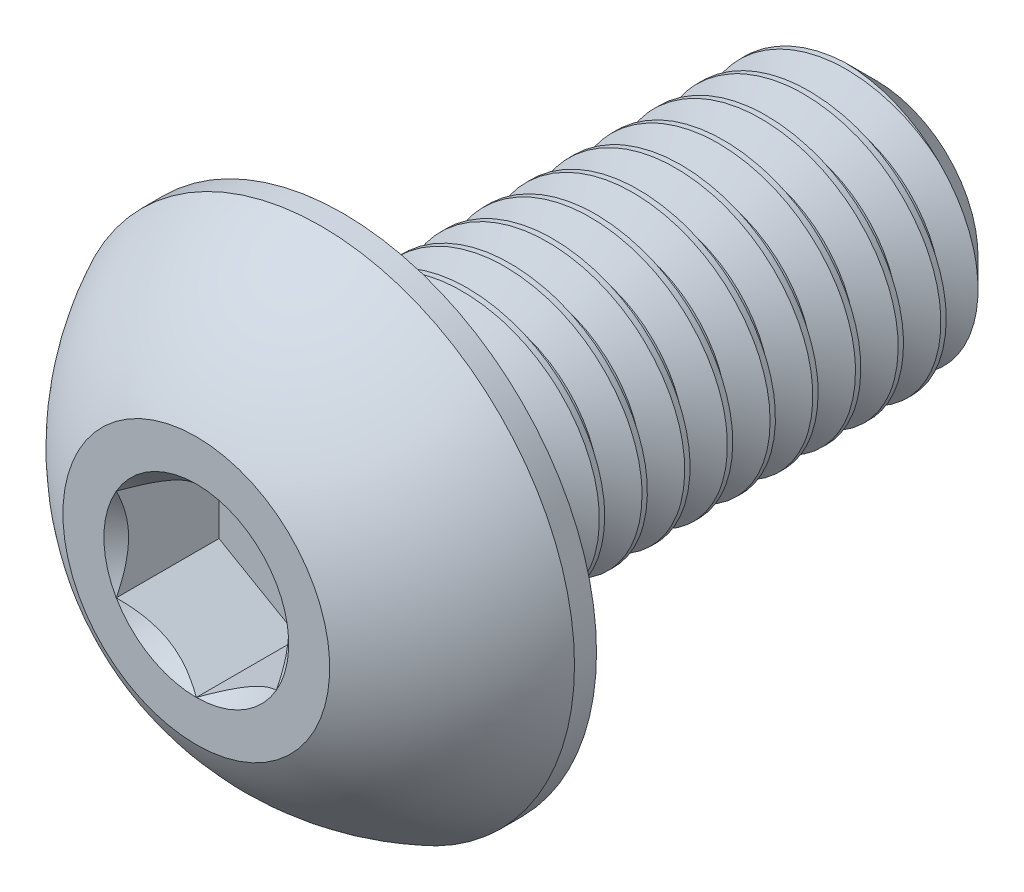
from build123d import *

# Parameters (mm, degrees)
SKETCH1_W          = 10
SKETCH1_H          = 2.5
CHAMFER1_SIZE      = 0.6
CUT_EXTRUDE2_DEPTH = 1.925
CUT_SWEEP1_PITCH   = 0.8


with BuildPart() as part:
    # Sketch1 → Revolve1 (revolve)
    with BuildSketch(Plane(origin=(0, 0, 0), x_dir=(0, 0, -1), z_dir=(1, 0, 0))):
        with Locations((7.75, 1.25)):
            Rectangle(SKETCH1_W, SKETCH1_H)
    revolve(axis=Axis((0, 0, -12.75), (0, 0, 1)))

    # Chamfer1
    chamfer1_edges = [part.edges().sort_by_distance(p)[0] for p in [
        (0, -2.5, -12.75),
    ]]
    chamfer(chamfer1_edges, length=CHAMFER1_SIZE)

    # Sketch7 → Revolve2 (revolve)
    with BuildSketch(Plane(origin=(0, 0, 0), x_dir=(0, 0, -1), z_dir=(1, 0, 0)), mode=Mode.PRIVATE) as revolve2_sk:
        with BuildLine():
            Line((2.3375, 4.75), (2.75, 4.75))
            Line((2.75, 4.75), (2.75, 0))
            Line((2.75, 0), (0, 0))
            Line((0, 0), (0, 2.5))
            ThreePointArc((0, 2.5), (0.991875183, 3.808753282), (2.3375, 4.75))
        make_face()
    revolve(revolve2_sk.sketch.rotate(Axis((0, 0, 0), (0, 0, -1)), 180), axis=Axis((0, 0, 0), (0, 0, -1)))

    # Sketch5 → Cut-Extrude2 (cut)
    with BuildSketch(Plane.XY):
        Polygon((1.5, -0.866025404), (1.5, 0.866025404), (0, 1.732050808), (-1.5, 0.866025404), (-1.5, -0.866025404), (0, -1.732050808), align=None)
    extrude(amount=-CUT_EXTRUDE2_DEPTH, mode=Mode.SUBTRACT)

    # Cut-Extrude3 cone 1 section (through the dimple's axis) → Cut-Extrude3 (revolve, cut)
    with BuildSketch(Plane(origin=(0, 0, 0), x_dir=(0, -1, 0), z_dir=(1, 0, 0))):
        Polygon((0, 0), (1.732050808, 0), (0, 1.732050808), align=None)
    revolve(axis=Axis((0, 0, 0), (0, 0, -1)), mode=Mode.SUBTRACT)

    # Cut-Sweep1: the profile of Sketch2 profile screwed along a right-hand helix of 13.5 turns, 8 arcs to a turn; built about Z, then put on its axis
    cut_sweep1_z = Axis((0, 0, 0), (0, 0, 1))
    cut_sweep1_corners = [(2.5003, 0, 0.600173205), (2.5003, 0, -0.100173205), (1.980384758, 0, 0.2), (1.980384758, 0, 0.3)]
    with BuildLine(mode=Mode.PRIVATE) as cut_sweep1_profile:
        Line(cut_sweep1_corners[0], cut_sweep1_corners[1])
        Line(cut_sweep1_corners[1], cut_sweep1_corners[2])
        Line(cut_sweep1_corners[2], cut_sweep1_corners[3])
        Line(cut_sweep1_corners[3], cut_sweep1_corners[0])
    cut_sweep1_cap = Face(cut_sweep1_profile.wire())
    cut_sweep1_turn_angles = [0, 22.5, 45, 67.5, 90, 112.5, 135, 157.5, 180, 202.5, 225, 247.5, 270, 292.5, 315, 337.5, 360]
    cut_sweep1_turn_weights = [1, 0.9238795325112867, 1, 0.9238795325112867, 1, 0.9238795325112867, 1, 0.9238795325112867, 1, 0.9238795325112867, 1, 0.9238795325112867, 1, 0.9238795325112867, 1, 0.9238795325112867, 1]
    cut_sweep1_turn_rails = [Edge.make_bspline([Vector(p[0], p[1], 0).rotate(cut_sweep1_z, cut_sweep1_turn_angles[k]) / cut_sweep1_turn_weights[k] + Vector(0, 0, p[2] + CUT_SWEEP1_PITCH * cut_sweep1_turn_angles[k] / 360) for k in range(17)], [0, 0, 0, 1, 1, 2, 2, 3, 3, 4, 4, 5, 5, 6, 6, 7, 7, 8, 8, 8], 2, cut_sweep1_turn_weights) for p in cut_sweep1_corners]
    cut_sweep1_turn_sides = [Face.make_surface_from_curves(cut_sweep1_turn_rails[p[0]], cut_sweep1_turn_rails[p[1]]) for p in [(0, 1), (1, 2), (2, 3), (3, 0)]]
    cut_sweep1_last_angles = [4680, 4702.5, 4725, 4747.5, 4770, 4792.5, 4815, 4837.5, 4860]
    cut_sweep1_last_weights = [1, 0.9238795325112867, 1, 0.9238795325112867, 1, 0.9238795325112867, 1, 0.9238795325112351, 1]
    cut_sweep1_last_rails = [Edge.make_bspline([Vector(p[0], p[1], 0).rotate(cut_sweep1_z, cut_sweep1_last_angles[k]) / cut_sweep1_last_weights[k] + Vector(0, 0, p[2] + CUT_SWEEP1_PITCH * cut_sweep1_last_angles[k] / 360) for k in range(9)], [0, 0, 0, 1, 1, 2, 2, 3, 3, 4, 4, 4], 2, cut_sweep1_last_weights) for p in cut_sweep1_corners]
    cut_sweep1_last_sides = [Face.make_surface_from_curves(cut_sweep1_last_rails[p[0]], cut_sweep1_last_rails[p[1]]) for p in [(0, 1), (1, 2), (2, 3), (3, 0)]]
    cut_sweep1 = Plane(origin=(0, 0, -12.75), x_dir=(0, 1, 0), z_dir=(0, 0, 1)) * Solid(Shell([*[p.moved(Location((0, 0, CUT_SWEEP1_PITCH * i))) for i in range(13) for p in cut_sweep1_turn_sides], *cut_sweep1_last_sides, cut_sweep1_cap, cut_sweep1_cap.rotate(cut_sweep1_z, 4860).moved(Location((0, 0, CUT_SWEEP1_PITCH * 4860 / 360)))]))
    add(cut_sweep1, mode=Mode.SUBTRACT)


solid = part.part
